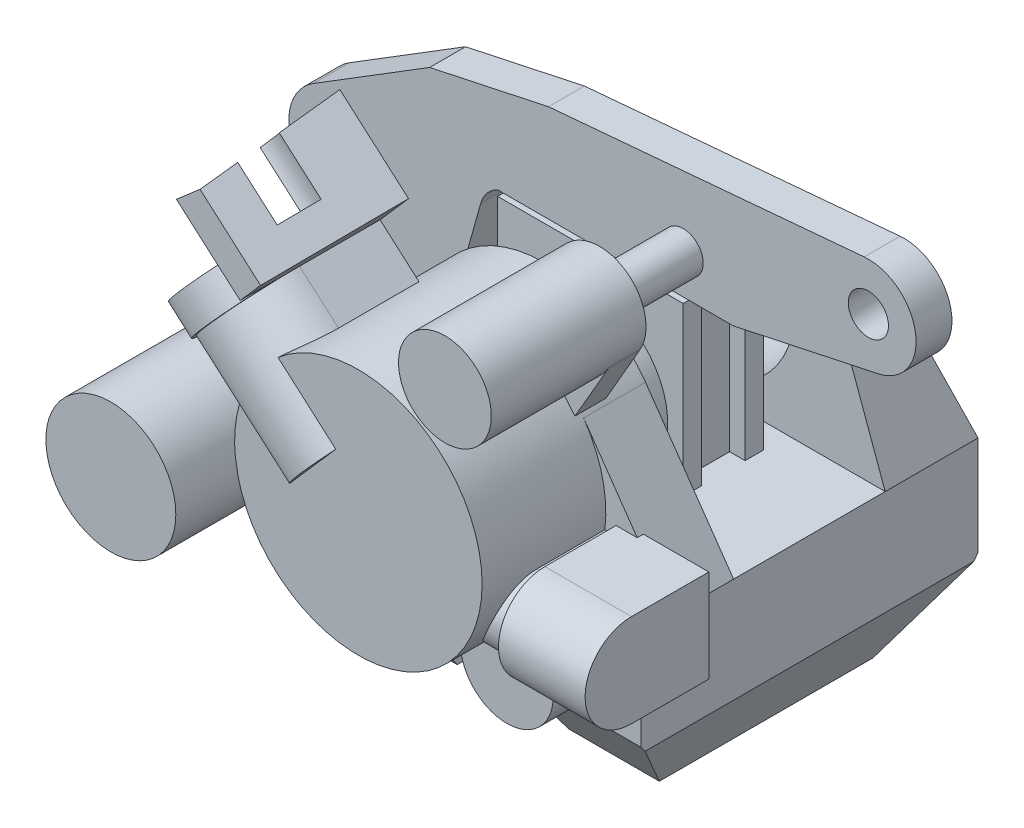
from build123d import *
from build123d.topology import SkipClean

# Parameters (mm, degrees)
CROQUIS4_W                    = 61.3
CROQUIS4_H                    = 54.5
SALIENTE_EXTRUIR1_DEPTH       = 29.3
CORTAR_EXTRUIR1_REACH         = 71.052
CROQUIS5_W                    = 18
CROQUIS5_H                    = 5.3
CHAFL_N2_SIZE                 = 10
CHAFL_N2_SIZE2                = 13.270448216
CROQUIS6_W                    = 18
CROQUIS6_H                    = 14.970448216
CORTAR_EXTRUIR2_DEPTH         = 7
SALIENTE_EXTRUIR2_DEPTH       = 15
SALIENTE_EXTRUIR2_DEPTH_BACK  = 15
CROQUIS7_R                    = 20
SALIENTE_EXTRUIR3_DEPTH       = 5
SALIENTE_EXTRUIR3_DEPTH_BACK  = 15
CROQUIS8_R                    = 7.5
SALIENTE_EXTRUIR4_DEPTH       = 25
SALIENTE_EXTRUIR4_DEPTH_BACK  = 10
CROQUIS9_R                    = 10.5
SALIENTE_EXTRUIR5_DEPTH       = 5
SALIENTE_EXTRUIR5_DEPTH_BACK  = 9
SALIENTE_EXTRUIR6_DEPTH       = 24
SALIENTE_EXTRUIR8_DEPTH       = 3
SALIENTE_EXTRUIR8_DEPTH_BACK  = 10
SALIENTE_EXTRUIR9_DEPTH       = 20
SALIENTE_EXTRUIR10_DEPTH      = 3
SALIENTE_EXTRUIR10_DEPTH_BACK = 2
SALIENTE_EXTRUIR11_START      = -25
CROQUIS17_R                   = 7.5
SALIENTE_EXTRUIR11_DEPTH      = 25
SALIENTE_EXTRUIR12_DEPTH      = 10
SALIENTE_EXTRUIR13_DEPTH      = 15
SALIENTE_EXTRUIR14_DEPTH      = 27
CROQUIS21_W                   = 25
CROQUIS21_H                   = 7
CORTAR_EXTRUIR3_DEPTH         = 2.5
SALIENTE_EXTRUIR15_START      = -17.5
CROQUIS22_R                   = 12.5
SALIENTE_EXTRUIR15_DEPTH      = 7.5
SALIENTE_EXTRUIR16_DEPTH      = 5.8
CORTAR_EXTRUIR5_START         = 12.25
CORTAR_EXTRUIR5_DEPTH         = 5
CROQUIS26_R                   = 3.25
SALIENTE_EXTRUIR17_DEPTH      = 13.5
CROQUIS25_R                   = 3.25
CORTAR_EXTRUIR7_DEPTH         = 86.721773981
CORTAR_EXTRUIR8_DEPTH         = 110.490999901
SALIENTE_EXTRUIR18_DEPTH      = 15
SALIENTE_EXTRUIR19_DEPTH      = 5
CROQUIS30_R                   = 4.75
CORTAR_EXTRUIR9_DEPTH         = 10
CORTAR_EXTRUIR10_DEPTH        = 10


# Read off the part's stored shape, not the designer's step: Cortar-Extruir5
with BuildPart() as part:
    # Croquis4 → Saliente-Extruir1 (new body)
    with BuildSketch(Plane(origin=(0, 0, 0), x_dir=(1, 0, 0), z_dir=(0, 1, 0))):
        Rectangle(CROQUIS4_W, CROQUIS4_H)
    extrude(amount=-SALIENTE_EXTRUIR1_DEPTH)

    # Croquis5 → Cortar-Extruir1 (cut, up to next)
    with BuildSketch(Plane.XY.offset(27.25), mode=Mode.PRIVATE) as cortar_extruir1_sk1:
        with Locations((0, -26.65)):
            Rectangle(CROQUIS5_W, CROQUIS5_H)
    cortar_extruir1_tool1 = extrude(cortar_extruir1_sk1.sketch, amount=-CORTAR_EXTRUIR1_REACH, mode=Mode.PRIVATE) & part.part
    # Croquis5 → Cortar-Extruir1 (cut, up to next)
    with BuildSketch(Plane.XY.offset(27.25), mode=Mode.PRIVATE) as cortar_extruir1_sk2:
        Polygon((-23.65, -29.3), (-30.65, -16.95), (-30.65, -29.3), align=None)
    cortar_extruir1_tool2 = extrude(cortar_extruir1_sk2.sketch, amount=-CORTAR_EXTRUIR1_REACH, mode=Mode.PRIVATE) & part.part
    # Croquis5 → Cortar-Extruir1 (cut, up to next)
    with BuildSketch(Plane.XY.offset(27.25), mode=Mode.PRIVATE) as cortar_extruir1_sk3:
        Polygon((23.65, -29.3), (30.65, -16.95), (30.65, -29.3), align=None)
    cortar_extruir1_tool3 = extrude(cortar_extruir1_sk3.sketch, amount=-CORTAR_EXTRUIR1_REACH, mode=Mode.PRIVATE) & part.part
    add(cortar_extruir1_tool1.solids().sort_by_distance((0, -26.65, 27.25))[0], mode=Mode.SUBTRACT)
    add(cortar_extruir1_tool2.solids().sort_by_distance((-28.316667, -25.183333, 27.25))[0], mode=Mode.SUBTRACT)
    add(cortar_extruir1_tool3.solids().sort_by_distance((28.316667, -25.183333, 27.25))[0], mode=Mode.SUBTRACT)

    # Chaflán2
    chafl_n2_edges = [part.edges().sort_by_distance(p)[0] for p in [
        (16.325, -29.3, -27.25),
        (16.325, -29.3, 27.25),
    ]]
    chafl_n2_side = [part.faces().sort_by_distance(p)[0] for p in [
        (16.325, -29.3, 0),
    ]]
    chamfer(chafl_n2_edges, length=CHAFL_N2_SIZE, length2=CHAFL_N2_SIZE2, reference=chafl_n2_side[0])

    # Croquis6 → Cortar-Extruir2 (cut)
    with BuildSketch(Plane.XY.offset(27.25)):
        with Locations((0, -16.514775892)):
            Rectangle(CROQUIS6_W, CROQUIS6_H)
    extrude(amount=-CORTAR_EXTRUIR2_DEPTH, mode=Mode.SUBTRACT)

    # Croquis7 → Saliente-Extruir2 (add, two sides: drawn at the far end of the back side and taken through both)
    with BuildSketch(Plane.XY.offset(27.25).offset(-SALIENTE_EXTRUIR2_DEPTH_BACK)):
        with Locations((0, 9)):
            Circle(CROQUIS7_R)
    extrude(amount=SALIENTE_EXTRUIR2_DEPTH + SALIENTE_EXTRUIR2_DEPTH_BACK)

    # Croquis8 → Saliente-Extruir3 (add, two sides: drawn at the far end of the back side and taken through both)
    with BuildSketch(Plane.XY.offset(27.25).offset(-SALIENTE_EXTRUIR3_DEPTH_BACK)):
        with Locations((14, -11.029551784)):
            Circle(CROQUIS8_R)
        with Locations((-14, -11.029551784)):
            Circle(CROQUIS8_R)
    extrude(amount=SALIENTE_EXTRUIR3_DEPTH + SALIENTE_EXTRUIR3_DEPTH_BACK)

    # Croquis9 → Saliente-Extruir4 (add, two sides: drawn at the far end of the back side and taken through both)
    with BuildSketch(Plane.XY.offset(27.25).offset(-SALIENTE_EXTRUIR4_DEPTH_BACK)):
        with Locations((-30, 3.970448216)):
            Circle(CROQUIS9_R)
    extrude(amount=SALIENTE_EXTRUIR4_DEPTH + SALIENTE_EXTRUIR4_DEPTH_BACK)

    # Croquis11 → Saliente-Extruir5 (add, two sides: drawn at the far end of the back side and taken through both)
    with BuildSketch(Plane(origin=(30.65, 0, 0), x_dir=(0, 0, -1), z_dir=(1, 0, 0)).offset(-SALIENTE_EXTRUIR5_DEPTH_BACK)):
        with BuildLine():
            Line((-21.25, -7), (-33.75, -7))
            ThreePointArc((-33.75, -7), (-41.25, 0.5), (-33.75, 8))
            Line((-33.75, 8), (-21.25, 8))
            Line((-21.25, 8), (-21.25, -7))
        make_face()
    extrude(amount=SALIENTE_EXTRUIR5_DEPTH + SALIENTE_EXTRUIR5_DEPTH_BACK)

    # Croquis12 → Saliente-Extruir6 (add)
    with BuildSketch(Plane(origin=(35.65, 0, 0), x_dir=(0, 0, -1), z_dir=(1, 0, 0))):
        with BuildLine():
            Line((-21.25, -5.5), (-21.25, 6.5))
            Line((-21.25, 6.5), (-33.25, 6.5))
            ThreePointArc((-33.25, 6.5), (-39.25, 0.5), (-33.25, -5.5))
            Line((-33.25, -5.5), (-21.25, -5.5))
        make_face()
    extrude(amount=-SALIENTE_EXTRUIR6_DEPTH)

    # Croquis14 → Saliente-Extruir8 (add, two sides: drawn at the far end of the back side and taken through both)
    with BuildSketch(Plane.XY.offset(32.25).offset(-SALIENTE_EXTRUIR8_DEPTH_BACK)):
        Polygon((-1.444534472, 18.546380505), (-16.496068366, 31.716472662), (-28.349151308, 18.170092157), (-13.297617414, 5), align=None)
    extrude(amount=SALIENTE_EXTRUIR8_DEPTH + SALIENTE_EXTRUIR8_DEPTH_BACK)

    # Croquis15 → Saliente-Extruir9 (add)
    with BuildSketch(Plane(origin=(-25.060803934, 21.928203442, 0), x_dir=(0, 0, 1), z_dir=(-0.7525766947068787, 0.6585046078685173, 0))):
        with BuildLine():
            Line((35.25, -4.993658867), (35.25, 13.006341133))
            ThreePointArc((35.25, 13.006341133), (44.25, 4.006341133), (35.25, -4.993658867))
        make_face()
    extrude(amount=-SALIENTE_EXTRUIR9_DEPTH)

    # Croquis16 → Saliente-Extruir10 (add, two sides: drawn at the far end of the back side and taken through both)
    with BuildSketch(Plane(origin=(0, 0, 21.25), x_dir=(-1, 0, 0), z_dir=(0, 0, -1)).offset(-SALIENTE_EXTRUIR10_DEPTH_BACK)):
        with BuildLine():
            Line((-8.5, 37.990381057), (-1, 25))
            Line((-1, 25), (-13.990381057, 17.5))
            Line((-13.990381057, 17.5), (-21.490381057, 30.490381057))
            ThreePointArc((-21.490381057, 30.490381057), (-18.745190528, 40.735571585), (-8.5, 37.990381057))
        make_face()
    extrude(amount=SALIENTE_EXTRUIR10_DEPTH + SALIENTE_EXTRUIR10_DEPTH_BACK)

    # Croquis17 → Saliente-Extruir11 (add)
    with SkipClean():  # the faces are left unmerged after this step: merging them gives an invalid solid
        with BuildSketch(Plane(origin=(0, 0, 18.25), x_dir=(-1, 0, 0), z_dir=(0, 0, -1)).offset(SALIENTE_EXTRUIR11_START)):
            with Locations((-14.995190528, 34.240381057)):
                Circle(CROQUIS17_R)
        extrude(amount=SALIENTE_EXTRUIR11_DEPTH)
    add(part.part.scale(1), mode=Mode.REPLACE)  # the faces are merged on a copy

    # Croquis18 → Saliente-Extruir12 (add)
    with BuildSketch(Plane.XY.offset(12.25)):
        with BuildLine():
            Line((30.65, 0), (16.408390364, 20.435240517))
            ThreePointArc((16.408390364, 20.435240517), (-5.51395587, 28.224887273), (-19.974984355, 10))
            Line((-19.974984355, 10), (-30.65, 10))
            Line((-30.65, 10), (-30.65, 0))
            Line((-30.65, 0), (30.65, 0))
        make_face()
    extrude(amount=SALIENTE_EXTRUIR12_DEPTH)

    # Croquis19 → Saliente-Extruir13 (add)
    with BuildSketch(Plane(origin=(0, 0, -27.25), x_dir=(-1, 0, 0), z_dir=(0, 0, -1))):
        with BuildLine():
            Line((-30.65, 0), (30.65, 0))
            Line((30.65, 0), (23, 21.018202259))
            Line((23, 21.018202259), (16, 21.018202259))
            Line((16, 21.018202259), (16, 18.018202259))
            ThreePointArc((16, 18.018202259), (0, 2.018202259), (-16, 18.018202259))
            Line((-16, 18.018202259), (-16, 21.018202259))
            Line((-16, 21.018202259), (-23, 21.018202259))
            Line((-23, 21.018202259), (-30.65, 0))
        make_face()
    extrude(amount=-SALIENTE_EXTRUIR13_DEPTH)

    # Croquis20 → Saliente-Extruir14 (add)
    with BuildSketch(Plane(origin=(0, 0, 0), x_dir=(1, 0, 0), z_dir=(0, 1, 0))):
        Polygon((-15, 5.25), (-12.5, 5.25), (-12.5, 1.75), (12.5, 1.75), (12.5, 5.25), (15, 5.25), (15, 8.25), (-15, 8.25), align=None)
    saliente_extruir14 = extrude(amount=SALIENTE_EXTRUIR14_DEPTH)

    # Simetría1: Saliente-Extruir14 across plane
    add(saliente_extruir14.mirror(Plane(origin=(-12.5, 27, -1.75), x_dir=(1, 0, 0), z_dir=(0, 0, -1))))

    # Croquis21 → Cortar-Extruir3 (cut)
    with SkipClean():  # the faces are left unmerged after this step: merging them gives an invalid solid
        with BuildSketch(Plane(origin=(0, 27, 0), x_dir=(1, 0, 0), z_dir=(0, 1, 0))):
            with Locations((0, 1.75)):
                Rectangle(CROQUIS21_W, CROQUIS21_H)
        extrude(amount=-CORTAR_EXTRUIR3_DEPTH, mode=Mode.SUBTRACT)

    # Croquis22 → Saliente-Extruir15 (add)
    with BuildSketch(Plane.XY.offset(22.25).offset(SALIENTE_EXTRUIR15_START)):
        with Locations((0, 9)):
            Circle(CROQUIS22_R)
    extrude(amount=SALIENTE_EXTRUIR15_DEPTH)

    # Cortar-Extruir5 outline → Cortar-Extruir5 (cut)
    with BuildSketch(Plane.XY.offset(CORTAR_EXTRUIR5_START)):
        with BuildLine():
            Line((-30.65, 10), (-30.65, 0))
            Line((-30.65, 0), (-17.860571099, 0))
            ThreePointArc((-17.860571099, 0), (-19.567378827, 4.862647482), (-19.974984355, 10))
            Line((-19.974984355, 10), (-30.65, 10))
        make_face()
    extrude(amount=CORTAR_EXTRUIR5_DEPTH, mode=Mode.SUBTRACT)

    # Croquis26 → Saliente-Extruir17 (add)
    with BuildSketch(Plane(origin=(0, 0, 18.25), x_dir=(-1, 0, 0), z_dir=(0, 0, -1))):
        with Locations(Location((-14.995190528, 34.240381057, 0), (0, 0, 180))):
            Circle(CROQUIS26_R)
        with Locations(Location((30, 3.970448216, 0), (0, 0, 180))):
            Circle(CROQUIS26_R)
    extrude(amount=SALIENTE_EXTRUIR17_DEPTH)

    # Croquis27 → Cortar-Extruir8 (cut, through all)
    with BuildSketch(Plane.ZY.offset(30.65)):
        Polygon((-27.25, 0), (-20.8240907, 21.018202259), (-27.25, 21.018202259), align=None)
    extrude(amount=-CORTAR_EXTRUIR8_DEPTH, mode=Mode.SUBTRACT)



with BuildPart() as body_2:
    # Croquis23 → Saliente-Extruir16 (new body)
    with BuildSketch(Plane.XY.offset(4.75)):
        with BuildLine():
            Line((-44.769767109, 27.908415043), (-25.972539186, 39.552194376))
            Line((-25.972539186, 39.552194376), (-6.757184018, 43.658324942))
            Line((-6.757184018, 43.658324942), (44.255864102, 48.147303088))
            ThreePointArc((44.255864102, 48.147303088), (52.554253117, 41.614111004), (46.54236984, 32.930614098))
            Line((46.54236984, 32.930614098), (23.082876702, 27.917553398))
            Line((23.082876702, 27.917553398), (-15.00360208, 27.917553398))
            ThreePointArc((-15.00360208, 27.917553398), (-16.711872119, 26.574707218), (-17.722383152, 24.651093472))
            Line((-17.722383152, 24.651093472), (-22.454082276, 7.767654496))
            ThreePointArc((-22.454082276, 7.767654496), (-30.388566077, 0.538919139), (-40.362723642, 4.504625749))
            Line((-40.362723642, 4.504625749), (-47.698970473, 16.766677308))
            ThreePointArc((-47.698970473, 16.766677308), (-48.456597665, 22.921778226), (-44.769767109, 27.908415043))
        make_face()
    extrude(amount=-SALIENTE_EXTRUIR16_DEPTH)

    # Croquis25 → Cortar-Extruir7 (cut, through all)
    with BuildSketch(Plane.XY.offset(4.75)):
        with Locations((44.93155545, 40.468701384)):
            Circle(CROQUIS25_R)
        with Locations((-40.362723642, 20.793869315)):
            Circle(CROQUIS25_R)
    extrude(amount=-CORTAR_EXTRUIR7_DEPTH, mode=Mode.SUBTRACT)


with BuildPart() as body_3:
    # Croquis28 → Saliente-Extruir18 (new body)
    with BuildSketch(Plane(origin=(-25.060803934, 21.928203442, 0), x_dir=(0, 0, 1), z_dir=(-0.7525766947068789, 0.6585046078685171, 0))):
        Polygon((22.25, 13.006341133), (44.85, 13.006341133), (44.85, 18.006341133), (22.25, 20.006341133), align=None)
    extrude(amount=SALIENTE_EXTRUIR18_DEPTH)


with BuildPart() as part_1:
    add(part.part)

    add(body_3.part)  # Saliente-Extruir19 merges body 3
    # Croquis29 → Saliente-Extruir19 (add)
    with BuildSketch(Plane(origin=(-25.060803934, 21.928203442, 0), x_dir=(0, 0, 1), z_dir=(-0.7525766947068789, 0.6585046078685171, 0))):
        with BuildLine():
            Line((22.25, 13.640534559), (22.25, -5.627852293))
            Line((22.25, -5.627852293), (35.25, -5.627852293))
            ThreePointArc((35.25, -5.627852293), (44.884193426, 4.006341133), (35.25, 13.640534559))
            Line((35.25, 13.640534559), (22.25, 13.640534559))
        make_face()
    extrude(amount=SALIENTE_EXTRUIR19_DEPTH)

    # Croquis30 → Cortar-Extruir9 (cut)
    with SkipClean():  # the faces are left unmerged after this step: merging them gives an invalid solid
        with BuildSketch(Plane(origin=(-36.349454354, 31.80577256, 0), x_dir=(0, 0, 1), z_dir=(-0.7525766947068789, 0.6585046078685171, 0))):
            with Locations((35.1, 15.506341133)):
                Circle(CROQUIS30_R)
        extrude(amount=-CORTAR_EXTRUIR9_DEPTH, mode=Mode.SUBTRACT)

    # Croquis31 → Cortar-Extruir10 (cut)
    with SkipClean():  # the faces are left unmerged after this step: merging them gives an invalid solid
        with BuildSketch(Plane(origin=(14.358433284, 16.409638039, 1.929611118), x_dir=(0.7548120551736586, -0.6514526302698987, -0.07660438550728446), z_dir=(0.6559411264469686, 0.7496470016536806, 0.08815107229710104))):
            Polygon((-49.476522514, -39.399877092), (-49.476522514, -14.485376724), (-51.166286947, -14.485376724), (-53.380891791, -41.459110359), align=None)
        extrude(amount=-CORTAR_EXTRUIR10_DEPTH, mode=Mode.SUBTRACT)


solid = Compound([body_2.part, part_1.part])
